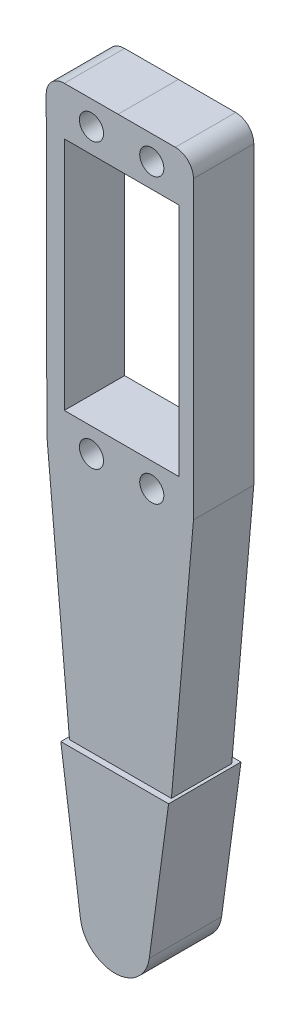
from build123d import *

# Parameters (mm, degrees)
BOSS_EXTRU_1_DEPTH           = 10
ESQUISSE2_W                  = 19
ESQUISSE2_H                  = 39
ENL_V_MAT_EXTRU_1_DEPTH      = 14
ENL_V_MAT_EXTRU_2_DEPTH      = 15
ENL_V_MAT_EXTRU_2_DEPTH_BACK = 7
ESQUISSE3_R                  = 2
CONG_1_R                     = 3
CONG_2_R                     = 3
BOSS_EXTRU_4_DEPTH           = 1
BOSS_EXTRU_4_DEPTH_BACK      = 11
CONG_4_R                     = 5.755572


with BuildPart() as part:
    # Esquisse1 → Boss.-Extru.1 (new body)
    with BuildSketch(Plane.XY):
        Polygon((-0.581785688, 80.233199881), (11.918214312, 80.233199881), (11.918214312, 28.233199881), (8.257673117, -13.606977439), (7.257673726, -13.608081293), (3.5, -40.345319149), (0, -40.345319149), (-3.826627386, -40.353406678), (-7.643319911, -13.624529819), (-8.643319302, -13.625633672), (-12.396222382, 28.206360286), (-12.511023087, 80.206233562), align=None)
    extrude(amount=BOSS_EXTRU_1_DEPTH)

    # Esquisse2 → Enlèv. mat.-Extru.1 (cut)
    with BuildSketch(Plane.XY.offset(10)):
        with Locations((0, 52.733199881)):
            Rectangle(ESQUISSE2_W, ESQUISSE2_H)
    extrude(amount=-ENL_V_MAT_EXTRU_1_DEPTH, mode=Mode.SUBTRACT)

    # Esquisse3 → Enlèv. mat.-Extru.2 (cut, two sides: drawn at the far end of the back side and taken through both)
    with BuildSketch(Plane.XY.offset(-ENL_V_MAT_EXTRU_2_DEPTH_BACK)):
        with Locations((5, 76.233199881)):
            Circle(ESQUISSE3_R)
        with Locations((5, 29.233199881)):
            Circle(ESQUISSE3_R)
        with Locations((-5, 29.233199881)):
            Circle(ESQUISSE3_R)
        with Locations((-5, 76.233199881)):
            Circle(ESQUISSE3_R)
    extrude(amount=ENL_V_MAT_EXTRU_2_DEPTH + ENL_V_MAT_EXTRU_2_DEPTH_BACK, mode=Mode.SUBTRACT)

    # Congé1
    cong_1_edges = [part.edges().sort_by_distance(p)[0] for p in [
        (11.918214312, 80.233199881, 5),
    ]]
    fillet(cong_1_edges, radius=CONG_1_R)

    # Congé2
    cong_2_edges = [part.edges().sort_by_distance(p)[0] for p in [
        (-12.511023087, 80.206233562, 5),
    ]]
    fillet(cong_2_edges, radius=CONG_2_R)

    # Esquisse4 → Boss.-Extru.4 (add, two sides: drawn at the far end of the back side and taken through both)
    with BuildSketch(Plane(origin=(0, 0, 0), x_dir=(-1, 0, 0), z_dir=(0, 0, -1)).offset(-BOSS_EXTRU_4_DEPTH_BACK)):
        Polygon((-8.792588162, -13.607529366), (9.080964972, -13.607529366), (5.141727933, -42.4046649), (-4.912145705, -42.4046649), align=None)
    extrude(amount=BOSS_EXTRU_4_DEPTH + BOSS_EXTRU_4_DEPTH_BACK)

    # Congé4
    cong_4_edges = [part.edges().sort_by_distance(p)[0] for p in [
        (4.912145705, -42.4046649, 5),
        (-5.141727933, -42.4046649, 5),
    ]]
    fillet(cong_4_edges, radius=CONG_4_R - 0.0001)  # a hair under: the kernel refuses the full size


solid = part.part
